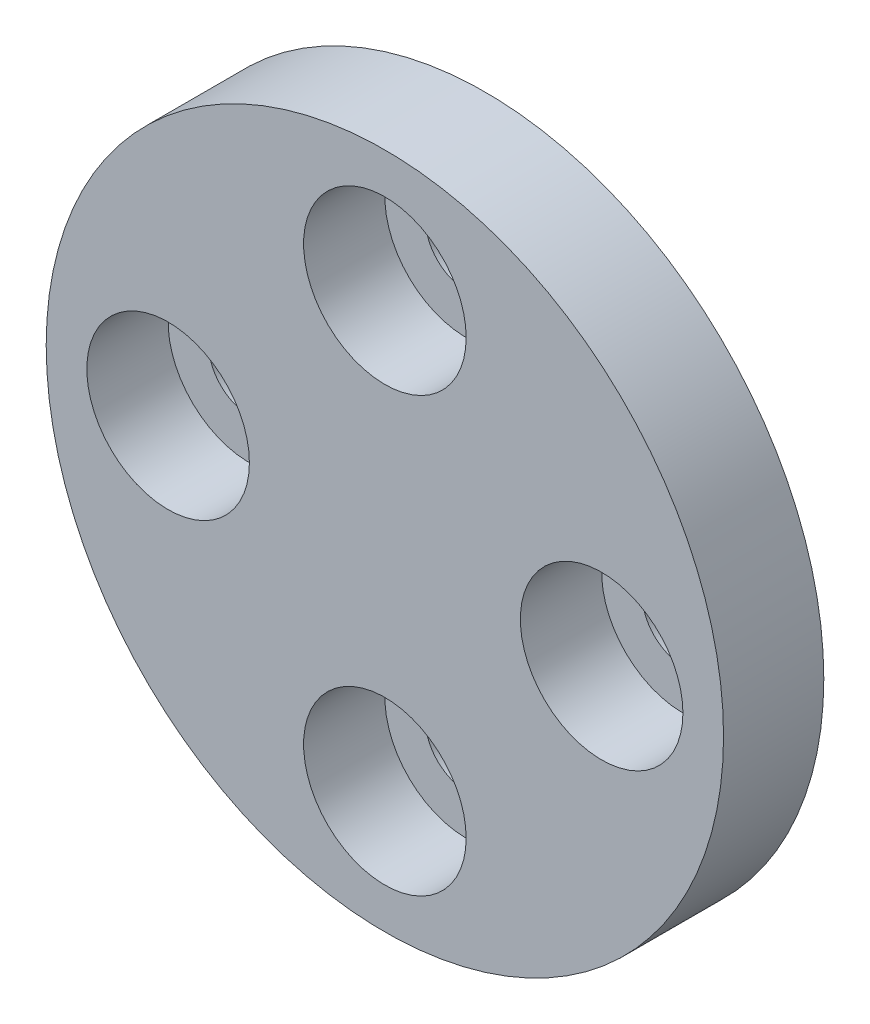
from build123d import *

# Parameters (mm, degrees)
SKIZZE1_R                       = 12.5
SKIZZE1_R_2                     = 1.5
AUFSATZ_LINEAR_AUSTRAGEN1_DEPTH = 3.7
SKIZZE2_R                       = 3
SCHNITT_LINEAR_AUSTRAGEN1_DEPTH = 3


with BuildPart() as part:
    # Skizze1 → Aufsatz-Linear austragen1 (new body)
    with BuildSketch(Plane.XY):
        Circle(SKIZZE1_R)
        with Locations((-8, 0)):
            Circle(SKIZZE1_R_2, mode=Mode.SUBTRACT)
        with Locations((8, 0)):
            Circle(SKIZZE1_R_2, mode=Mode.SUBTRACT)
        with Locations((0, 8)):
            Circle(SKIZZE1_R_2, mode=Mode.SUBTRACT)
        with Locations((0, -8)):
            Circle(SKIZZE1_R_2, mode=Mode.SUBTRACT)
    extrude(amount=AUFSATZ_LINEAR_AUSTRAGEN1_DEPTH)

    # Skizze2 → Schnitt-Linear austragen1 (cut)
    with BuildSketch(Plane.XY.offset(3.7)):
        with Locations((0, 8)):
            Circle(SKIZZE2_R)
        with Locations((8, 0)):
            Circle(SKIZZE2_R)
        with Locations((0, -8)):
            Circle(SKIZZE2_R)
        with Locations((-8, 0)):
            Circle(SKIZZE2_R)
    extrude(amount=-SCHNITT_LINEAR_AUSTRAGEN1_DEPTH, mode=Mode.SUBTRACT)


solid = part.part
